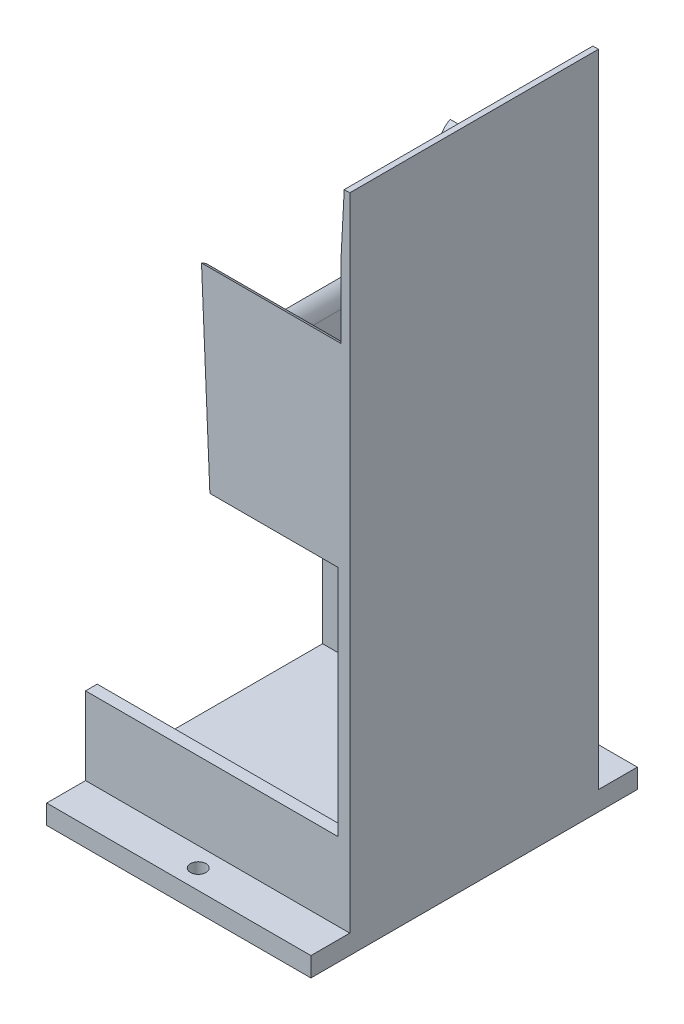
from build123d import *

# Parameters (mm, degrees)
CROQUIS1_W              = 68
CROQUIS1_H              = 64
CROQUIS1_W_2            = 61.625
CROQUIS1_H_2            = 58
SALIENTE_EXTRUIR1_DEPTH = 25
SALIENTE_EXTRUIR2_DEPTH = 160
SALIENTE_EXTRUIR3_DEPTH = 61
SALIENTE_EXTRUIR5_DEPTH = 3
CROQUIS4_W              = 100
CROQUIS4_H              = 30
CORTAR_EXTRUIR1_DEPTH   = 83
CHAFL_N1_SIZE           = 2
CHAFL_N1_SIZE2          = 57.272506566
CROQUIS1_2_W            = 68
CROQUIS1_2_H            = 64
CROQUIS1_2_W_2          = 61.625
CROQUIS1_2_H_2          = 58
SALIENTE_EXTRUIR6_DEPTH = 5
CROQUIS5_W              = 40
CROQUIS5_H              = 60
CORTAR_EXTRUIR2_DEPTH   = 90
CROQUIS1_4_W            = 68
CROQUIS1_4_H            = 10
CROQUIS1_4_R            = 2
SALIENTE_EXTRUIR7_DEPTH = 5
CROQUIS6_W              = 75.447981844
CROQUIS6_H              = 15
CORTAR_EXTRUIR3_DEPTH   = 5
CHAFL_N2_SIZE           = 30
CHAFL_N2_SIZE_2         = 1.572233378
CHAFL_N3_SIZE           = 5
CHAFL_N3_SIZE2          = 0.881634904
CROQUIS7_W              = 58
CROQUIS7_H              = 20
CORTAR_EXTRUIR4_DEPTH   = 40
CROQUIS8_W              = 58
CROQUIS8_H              = 40
CORTAR_EXTRUIR5_DEPTH   = 10
REDONDEO2_R             = 5
CORTAR_EXTRUIR6_DEPTH   = 70
REDONDEO5_R             = 5


with BuildPart() as part:
    # Croquis1 → Saliente-Extruir1 (new body)
    with BuildSketch(Plane(origin=(0, 0, 0), x_dir=(1, 0, 0), z_dir=(0, 1, 0))):
        Rectangle(CROQUIS1_W, CROQUIS1_H)
        Rectangle(CROQUIS1_W_2, CROQUIS1_H_2, mode=Mode.SUBTRACT)
    extrude(amount=SALIENTE_EXTRUIR1_DEPTH)

    # Croquis2 → Saliente-Extruir2 (add)
    with BuildSketch(Plane(origin=(0, 25, 0), x_dir=(1, 0, 0), z_dir=(0, 1, 0))):
        Polygon((0, 29), (0, 32), (34, 32), (34, -32), (0, -32), (0, -29), (30.8125, -29), (30.8125, 29), align=None)
    extrude(amount=SALIENTE_EXTRUIR2_DEPTH)



with BuildPart() as body_2:
    # Croquis3 → Saliente-Extruir3 (new body)
    with BuildSketch(Plane(origin=(0, 0, 29), x_dir=(-1, 0, 0), z_dir=(0, 0, -1))):
        Polygon((0, 155), (5, 155), (2, 85), (0, 85), align=None)
    extrude(amount=SALIENTE_EXTRUIR3_DEPTH)


with BuildPart() as part_1:
    add(part.part)

    add(body_2.part)  # Saliente-Extruir5 merges body 2
    # Croquis3<4> → Saliente-Extruir5 (add)
    with BuildSketch(Plane(origin=(0, 0, 29), x_dir=(-1, 0, 0), z_dir=(0, 0, -1))):
        Polygon((0, 155), (5, 155), (2, 85), (0, 85), align=None)
    extrude(amount=-SALIENTE_EXTRUIR5_DEPTH)

    # Croquis4 → Cortar-Extruir1 (cut)
    with BuildSketch(Plane(origin=(0, 0, -32), x_dir=(-1, 0, 0), z_dir=(0, 0, -1))):
        with Locations((19, 170)):
            Rectangle(CROQUIS4_W, CROQUIS4_H)
    extrude(amount=-CORTAR_EXTRUIR1_DEPTH, mode=Mode.SUBTRACT)

    # Chaflán1
    chafl_n1_edges = [part_1.edges().sort_by_distance(p)[0] for p in [
        (0, 155, 0),
    ]]
    chafl_n1_side = [part_1.faces().sort_by_distance(p)[0] for p in [
        (13, 155, -31.26569761),
    ]]
    chamfer(chafl_n1_edges, length=CHAFL_N1_SIZE, length2=CHAFL_N1_SIZE2, reference=chafl_n1_side[0])

    # Croquis1<2> → Saliente-Extruir6 (add)
    # profile 1 of 2: a face of its own
    with BuildSketch(Plane(origin=(0, 0, 0), x_dir=(1, 0, 0), z_dir=(0, 1, 0))):
        Rectangle(CROQUIS1_2_W, CROQUIS1_2_H)
        Rectangle(CROQUIS1_2_W_2, CROQUIS1_2_H_2, mode=Mode.SUBTRACT)
    # profile 2 of 2: a face of its own
    with BuildSketch(Plane(origin=(0, 0, 0), x_dir=(1, 0, 0), z_dir=(0, 1, 0))):
        Rectangle(CROQUIS1_2_W_2, CROQUIS1_2_H_2)
    extrude(amount=SALIENTE_EXTRUIR6_DEPTH)

    # Croquis5 → Cortar-Extruir2 (cut)
    with BuildSketch(Plane(origin=(0, 0, -32), x_dir=(-1, 0, 0), z_dir=(0, 0, -1))):
        with Locations((-11, 55)):
            Rectangle(CROQUIS5_W, CROQUIS5_H)
    extrude(amount=-CORTAR_EXTRUIR2_DEPTH, mode=Mode.SUBTRACT)

    # Croquis1<4> → Saliente-Extruir7 (add)
    # profile 1 of 2: a face of its own
    with BuildSketch(Plane(origin=(0, 0, 0), x_dir=(1, 0, 0), z_dir=(0, 1, 0))):
        with Locations((0, 37)):
            Rectangle(CROQUIS1_4_W, CROQUIS1_4_H)
        with Locations(Location((0, 37, 0), (0, 0, 270))):
            Circle(CROQUIS1_4_R, mode=Mode.SUBTRACT)
    # profile 2 of 2: a face of its own
    with BuildSketch(Plane(origin=(0, 0, 0), x_dir=(1, 0, 0), z_dir=(0, 1, 0))):
        with Locations((0, -37)):
            Rectangle(CROQUIS1_4_W, CROQUIS1_4_H)
        with Locations(Location((0, -37, 0), (0, 0, 270))):
            Circle(CROQUIS1_4_R, mode=Mode.SUBTRACT)
    extrude(amount=SALIENTE_EXTRUIR7_DEPTH)

    # Croquis6 → Cortar-Extruir3 (cut)
    with BuildSketch(Plane.ZY.offset(-31)):
        with Locations((5.723990922, 177.5)):
            Rectangle(CROQUIS6_W, CROQUIS6_H)
    extrude(amount=-CORTAR_EXTRUIR3_DEPTH, mode=Mode.SUBTRACT)

    # Chaflán2
    # the kernel refuses this chamfer: 30, 1.572233378 mm, written as the material it takes off along each edge
    with BuildSketch(Plane(origin=(31, 170, -109.996046635), x_dir=(-0.002013023422382327, -0.9999979738662979, 0), z_dir=(0, 0, 1))) as chafl_n2_piece_1_section:
        Polygon((CHAFL_N2_SIZE * 0.999997973866, CHAFL_N2_SIZE * 0.00201302342238), (-CHAFL_N2_SIZE_2 * 0.00201302342301, CHAFL_N2_SIZE_2 * 0.999997974179), (0, 0), align=None)
    chafl_n2_piece_1 = extrude(amount=219.992093269, mode=Mode.PRIVATE)
    chafl_n2_piece_1 = split(chafl_n2_piece_1, bisect_by=Plane(origin=(31.611424092, 155, 0), z_dir=(0, 1, 0)), keep=Keep.TOP, mode=Mode.PRIVATE)
    add(chafl_n2_piece_1, mode=Mode.SUBTRACT)

    # Chaflán3
    chafl_n3_edges = [part_1.edges().sort_by_distance(p)[0] for p in [
        (30.8125, 155, 0),
    ]]
    chafl_n3_side = [part_1.faces().sort_by_distance(p)[0] for p in [
        (30.8125, 120, 0),
    ]]
    chamfer(chafl_n3_edges, length=CHAFL_N3_SIZE, length2=CHAFL_N3_SIZE2, reference=chafl_n3_side[0])

    # Croquis7 → Cortar-Extruir4 (cut)
    with BuildSketch(Plane.ZY.offset(34)):
        with Locations((0, 15)):
            Rectangle(CROQUIS7_W, CROQUIS7_H)
    extrude(amount=-CORTAR_EXTRUIR4_DEPTH, mode=Mode.SUBTRACT)

    # Croquis8 → Cortar-Extruir5 (cut)
    with BuildSketch(Plane(origin=(1.639845182, 0.070279079, 0), x_dir=(0, 0, 1), z_dir=(-0.9990828958176697, -0.04281783839218585, 0))):
        with Locations((0, 135.071938044)):
            Rectangle(CROQUIS8_W, CROQUIS8_H)
    extrude(amount=-CORTAR_EXTRUIR5_DEPTH, mode=Mode.SUBTRACT)

    # Redondeo2
    # the kernel refuses this fillet: 5 mm, written as the material it takes off along each edge
    with BuildSketch(Plane(origin=(-0.608459404, 115.151491041, 29), x_dir=(0.034899496702498145, -0.9993908270190959, 0), z_dir=(0, 0, -1))) as redondeo2_piece_1:
        with BuildLine():
            CenterArc((4.451052559, 5), REDONDEO2_R, 207.629976372, 62.370023628)
            Line((0.021247221, 2.681201893), (0, 0))
            Line((0, 0), (4.451052559, 0))
        make_face()
    extrude(amount=58, mode=Mode.SUBTRACT)

    # Croquis9 → Cortar-Extruir6 (cut)
    with BuildSketch(Plane.XY.offset(32)):
        Polygon((-5, 155), (-4.15481256, 135.278959735), (31.786116689, 135.278959735), (31.786116689, 137.80344281), (31.786116689, 155), (-4.263004692, 155), align=None)
    extrude(amount=-CORTAR_EXTRUIR6_DEPTH, mode=Mode.SUBTRACT)

    # Redondeo5
    # the kernel refuses this fillet: 5 mm, written as the material it takes off along each edge
    with BuildSketch(Plane(origin=(30.8125, 135.278959735, 29), x_dir=(0, 0, 1), z_dir=(-1, 0, 0))) as redondeo5_piece_1_section:
        with BuildLine():
            CenterArc((5, -4.582575695), REDONDEO5_R, 113.578178478, 66.421821522)
            Line((0, -4.582575695), (-0.1, -4.582575695))
            Line((-0.1, -4.582575695), (-0.1, 0))
            Line((-0.1, 0), (0, 0.1))
            ThreePointArc((0, 0.1), (1.5, 0.1), (2.96, 0.091651514))
            Line((2.96, 0.091651514), (3, 0))
        make_face()
    redondeo5_piece_1 = extrude(amount=46.423751797, mode=Mode.PRIVATE)
    redondeo5_piece_1 = split(redondeo5_piece_1, bisect_by=Plane(origin=(-4.075030571, 133.417379989, 29.7763393), z_dir=(0.9990828958176697, 0.042817838392185836, 0)), keep=Keep.TOP, mode=Mode.PRIVATE)
    add(redondeo5_piece_1, mode=Mode.SUBTRACT)
    with BuildSketch(Plane(origin=(-15.611251797, 135.278959735, -29), x_dir=(0, -1, 0), z_dir=(1, 0, 0))) as redondeo5_piece_2_section:
        with BuildLine():
            CenterArc((4.582575695, 5), REDONDEO5_R, 203.578178478, 66.421821522)
            Line((0, 3), (-0.091651514, 2.96))
            ThreePointArc((-0.091651514, 2.96), (-0.1, 1.5), (-0.1, 0))
            Line((-0.1, 0), (0, -0.1))
            Line((0, -0.1), (4.582575695, -0.1))
            Line((4.582575695, -0.1), (4.582575695, 0))
        make_face()
    redondeo5_piece_2 = extrude(amount=46.423751797, mode=Mode.PRIVATE)
    redondeo5_piece_2 = split(redondeo5_piece_2, bisect_by=Plane(origin=(-4.075030571, 133.417379989, -29.7763393), z_dir=(0.9990828958176697, 0.042817838392185836, 0)), keep=Keep.TOP, mode=Mode.PRIVATE)
    add(redondeo5_piece_2, mode=Mode.SUBTRACT)
    with BuildSketch(Plane(origin=(30.8125, 135.278959735, -29), x_dir=(1, 0, 0), z_dir=(0, 0, 1))) as redondeo5_piece_3:
        with BuildLine():
            CenterArc((5, -2.964496152), REDONDEO5_R, 143.636982553, 36.363017447)
            Line((0, -2.964496152), (-0.1, -2.964496152))
            Line((-0.1, -2.964496152), (-0.1, 0))
            Line((-0.1, 0), (0, 0.1))
            ThreePointArc((0, 0.1), (0.486808345, 0.1), (0.893089023, 0.059289923))
            Line((0.893089023, 0.059289923), (0.973616689, 0))
        make_face()
    extrude(amount=58, mode=Mode.SUBTRACT)
    with BuildSketch(Plane(origin=(30.8125, 135.278959735, -29), x_dir=(1, 0, 0), z_dir=(0, 0, 1))) as redondeo5_piece_4a_section:
        with BuildLine():
            CenterArc((5, -2.964496152), REDONDEO5_R, 143.636982553, 36.363017447)
            Line((0, -2.964496152), (-0.1, -2.964496152))
            Line((-0.1, -2.964496152), (-0.1, 0))
            Line((-0.1, 0), (0, 0.1))
            ThreePointArc((0, 0.1), (0.486808345, 0.1), (0.893089023, 0.059289923))
            Line((0.893089023, 0.059289923), (0.973616689, 0))
        make_face()
    redondeo5_piece_4a = extrude(amount=65.41124038, mode=Mode.PRIVATE)
    redondeo5_piece_4a = split(redondeo5_piece_4a, bisect_by=Plane(origin=(31.030991271, 134.436005592, 29), z_dir=(0, 0, 1)), keep=Keep.TOP, mode=Mode.PRIVATE)
    with BuildSketch(Plane(origin=(42.268939237, 135.278959735, 29), x_dir=(0, 0, 1), z_dir=(-1, 0, 0))) as redondeo5_piece_4b_section:
        with BuildLine():
            CenterArc((5, -4.582575695), REDONDEO5_R, 113.578178478, 66.421821522)
            Line((0, -4.582575695), (-0.1, -4.582575695))
            Line((-0.1, -4.582575695), (-0.1, 0))
            Line((-0.1, 0), (0, 0.1))
            ThreePointArc((0, 0.1), (1.5, 0.1), (2.96, 0.091651514))
            Line((2.96, 0.091651514), (3, 0))
        make_face()
    redondeo5_piece_4b = extrude(amount=57.880191035, mode=Mode.PRIVATE)
    redondeo5_piece_4b = split(redondeo5_piece_4b, bisect_by=Plane(origin=(30.8125, 134.163022014, 29.775816439), z_dir=(1, 0, 0)), keep=Keep.TOP, mode=Mode.PRIVATE)
    redondeo5_piece_4 = redondeo5_piece_4a & redondeo5_piece_4b
    add(redondeo5_piece_4, mode=Mode.SUBTRACT)
    with BuildSketch(Plane(origin=(-15.611251797, 135.278959735, -29), x_dir=(0, -1, 0), z_dir=(1, 0, 0))) as redondeo5_piece_5a_section:
        with BuildLine():
            CenterArc((4.582575695, 5), REDONDEO5_R, 203.578178478, 66.421821522)
            Line((0, 3), (-0.091651514, 2.96))
            ThreePointArc((-0.091651514, 2.96), (-0.1, 1.5), (-0.1, 0))
            Line((-0.1, 0), (0, -0.1))
            Line((0, -0.1), (4.582575695, -0.1))
            Line((4.582575695, -0.1), (4.582575695, 0))
        make_face()
    redondeo5_piece_5a = extrude(amount=57.880191035, mode=Mode.PRIVATE)
    redondeo5_piece_5a = split(redondeo5_piece_5a, bisect_by=Plane(origin=(30.8125, 134.163022014, -29.775816439), z_dir=(1, 0, 0)), keep=Keep.TOP, mode=Mode.PRIVATE)
    with BuildSketch(Plane(origin=(30.8125, 135.278959735, -36.41124038), x_dir=(1, 0, 0), z_dir=(0, 0, 1))) as redondeo5_piece_5b_section:
        with BuildLine():
            CenterArc((5, -2.964496152), REDONDEO5_R, 143.636982553, 36.363017447)
            Line((0, -2.964496152), (-0.1, -2.964496152))
            Line((-0.1, -2.964496152), (-0.1, 0))
            Line((-0.1, 0), (0, 0.1))
            ThreePointArc((0, 0.1), (0.486808345, 0.1), (0.893089023, 0.059289923))
            Line((0.893089023, 0.059289923), (0.973616689, 0))
        make_face()
    redondeo5_piece_5b = extrude(amount=65.41124038, mode=Mode.PRIVATE)
    redondeo5_piece_5b = split(redondeo5_piece_5b, bisect_by=Plane(origin=(31.030991271, 134.436005592, -29), z_dir=(0, 0, -1)), keep=Keep.TOP, mode=Mode.PRIVATE)
    redondeo5_piece_5 = redondeo5_piece_5a & redondeo5_piece_5b
    add(redondeo5_piece_5, mode=Mode.SUBTRACT)


solid = part_1.part
